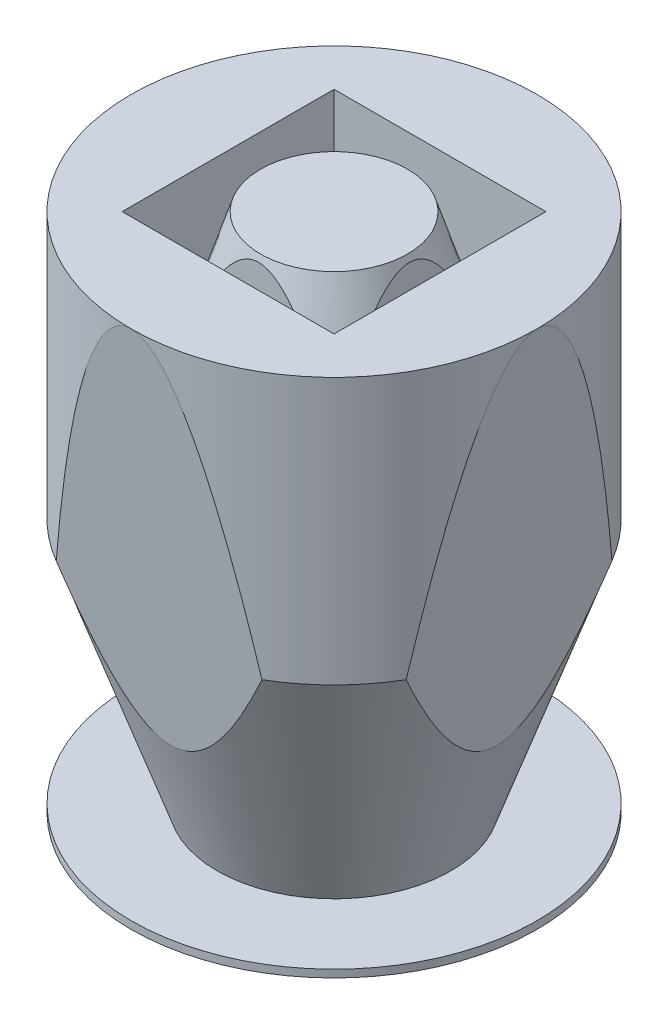
from build123d import *

# Parameters (mm, degrees)
SKETCH2_W           = 8.35
SKETCH2_H           = 8.35
CUT_EXTRUDE1_DEPTH  = 10
SKETCH3_W           = 5.95
SKETCH3_H           = 5.95
BOSS_EXTRUDE1_DEPTH = 10
SKETCH6_W           = 20
SKETCH6_H           = 20
SKETCH6_W_2         = 16
SKETCH6_H_2         = 16
CUT_EXTRUDE2_DEPTH  = 15
CUT_EXTRUDE2_DRAFT  = 6
BOSS_EXTRUDE2_START = 0.3
SKETCH5_R           = 8
BOSS_EXTRUDE2_DEPTH = 0.3


with BuildPart() as part:
    # Sketch1 → Revolve1 (revolve)
    with BuildSketch(Plane.XY):
        Polygon((3.7, 10), (3.7, 0), (4.5, 0), (8, 10), (8, 20.5), (0, 20.5), (0, 10), align=None)
    revolve(axis=Axis((0, 0, 0), (0, 1, 0)))

    # Sketch2 → Cut-Extrude1 (cut)
    with BuildSketch(Plane(origin=(0, 20.5, 0), x_dir=(1, 0, 0), z_dir=(0, 1, 0))):
        Rectangle(SKETCH2_W, SKETCH2_H)
    extrude(amount=-CUT_EXTRUDE1_DEPTH, mode=Mode.SUBTRACT)


with BuildPart() as body_2:
    # Sketch3 → Boss-Extrude1 (new body)
    with BuildSketch(Plane(origin=(0, 10.5, 0), x_dir=(1, 0, 0), z_dir=(0, 1, 0))):
        Rectangle(SKETCH3_W, SKETCH3_H)
    extrude(amount=BOSS_EXTRUDE1_DEPTH)

    # Sketch4 → Cut-Revolve1 (revolve, cut)
    with BuildSketch(Plane.XY, mode=Mode.PRIVATE) as cut_revolve1_sk:
        Polygon((1, 26.5), (7.325, 6.5), (7.325, 26.5), align=None)
    revolve(cut_revolve1_sk.sketch.rotate(Axis((0, 20.5, 0), (0, 1, 0)), 315.000122561), axis=Axis((0, 20.5, 0), (0, 1, 0)), mode=Mode.SUBTRACT)


with BuildPart() as cut_extrude2_tool:
    # Sketch6 → Cut-Extrude2 (with draft: the straight prism first)
    with BuildSketch(Plane(origin=(0, 20.5, 0), x_dir=(1, 0, 0), z_dir=(0, 1, 0))):
        Rectangle(SKETCH6_W, SKETCH6_H)
        Rectangle(SKETCH6_W_2, SKETCH6_H_2, mode=Mode.SUBTRACT)
    extrude(amount=-CUT_EXTRUDE2_DEPTH)
    # Cut-Extrude2: the draft: its side faces are tilted about the plane it starts from
    cut_extrude2_sides = [cut_extrude2_tool.faces().sort_by_distance(p)[0] for p in [
        (-10, 13, 0),
        (0, 13, 10),
        (10, 13, 0),
        (0, 13, -10),
        (0, 13, -8),
        (8, 13, 0),
        (0, 13, 8),
        (-8, 13, 0),
    ]]
    draft(cut_extrude2_sides, Plane(origin=(0, 20.5, 0), x_dir=(1, 0, 0), z_dir=(0, 1, 0)), CUT_EXTRUDE2_DRAFT)


with BuildPart() as part_1:
    add(part.part)

    # Cut-Extrude2: cut by cut_extrude2_tool
    add(cut_extrude2_tool.part, mode=Mode.SUBTRACT)

    # Intersect2: read off the stored shape, not the designer's step
    # Intersect2: union body 2
    add(body_2.part)

    # Sketch5 → Boss-Extrude2 (add)
    with BuildSketch(Plane(origin=(0, 0, 0), x_dir=(1, 0, 0), z_dir=(0, 1, 0)).offset(BOSS_EXTRUDE2_START)):
        with Locations(Location((0, 0, 0), (0, 0, 270))):
            Circle(SKETCH5_R)
    extrude(amount=-BOSS_EXTRUDE2_DEPTH)


solid = part_1.part
